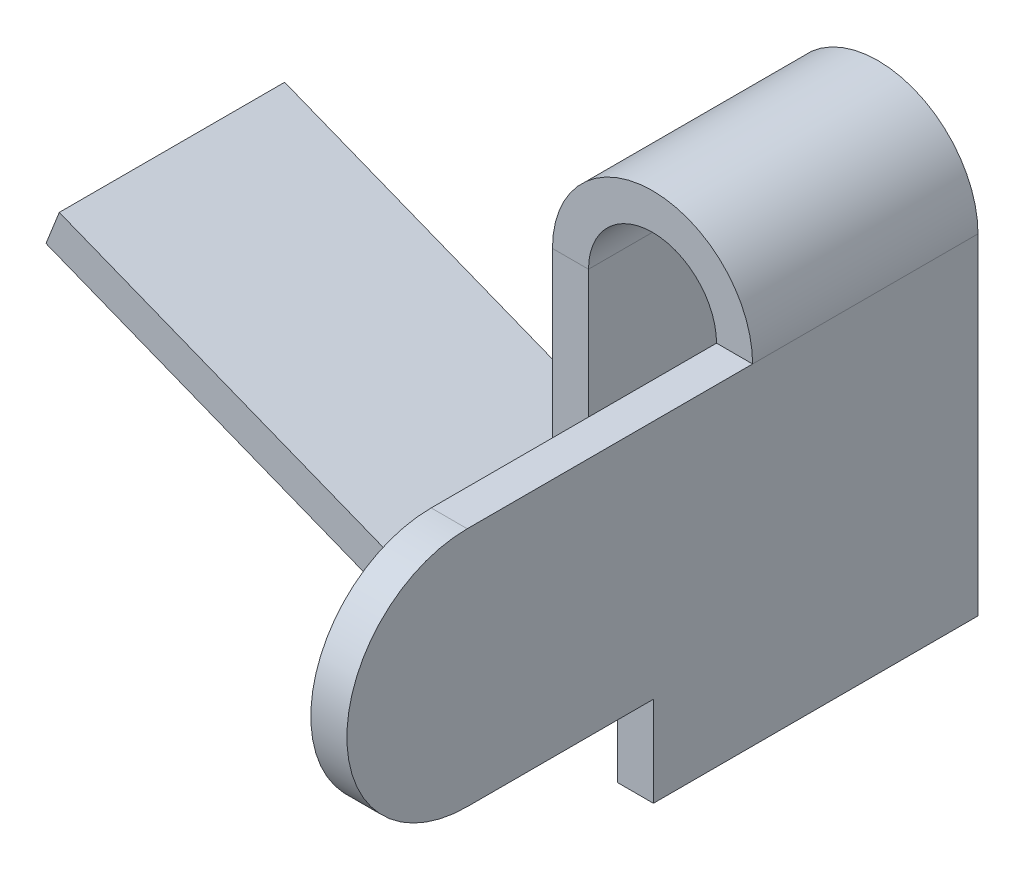
from build123d import *

# Parameters (mm, degrees)
BASE_FLANGE1_DEPTH  = 2.5
SKETCH6_W           = 0.4
SKETCH6_H           = 3.67
BOSS_EXTRUDE1_DEPTH = 4.5
SKETCH7_W           = 3.4
SKETCH7_H           = 1
CUT_EXTRUDE1_DEPTH  = 4.5
FILLET1_RADIUS      = 1.335
FILLET1_LENGTH      = 0.4


# Sheet-metal steps are written as plain solids
with BuildPart() as part:
    # Sketch1 → Base-Flange1 (new body)
    with BuildSketch(Plane.XY):
        with BuildLine():
            Line((0.71, 0), (0.71, 3.67))
            ThreePointArc((0.71, 3.67), (0, 4.38), (-0.71, 3.67))
            Line((-0.71, 3.67), (-0.71, -0.5))
            ThreePointArc((-0.71, -0.5), (-0.998929703, -1.045808423), (-1.612747985, -1.113737253))
            Line((-1.612747985, -1.113737253), (-6.727225094, 0.909162621))
            Line((-6.727225094, 0.909162621), (-6.580105103, 1.281124592))
            Line((-6.580105103, 1.281124592), (-1.465627994, -0.741775282))
            ThreePointArc((-1.465627994, -0.741775282), (-1.223820792, -0.71501544), (-1.11, -0.5))
            Line((-1.11, -0.5), (-1.11, 3.67))
            ThreePointArc((-1.11, 3.67), (0, 4.78), (1.11, 3.67))
            Line((1.11, 3.67), (1.11, 0))
            Line((1.11, 0), (0.71, 0))
        make_face()
    extrude(amount=BASE_FLANGE1_DEPTH)

    # Sketch6 → Boss-Extrude1 (add)
    with BuildSketch(Plane.XY.offset(2.5)):
        with Locations((0.91, 1.835)):
            Rectangle(SKETCH6_W, SKETCH6_H)
    extrude(amount=BOSS_EXTRUDE1_DEPTH)

    # Sketch7 → Cut-Extrude1 (cut)
    with BuildSketch(Plane(origin=(1.11, 0, 0), x_dir=(0, 0, -1), z_dir=(1, 0, 0))):
        with Locations((-5.3, 0.5)):
            Rectangle(SKETCH7_W, SKETCH7_H)
    extrude(amount=-CUT_EXTRUDE1_DEPTH, mode=Mode.SUBTRACT)

    # Fillet1: full round fillet: the end face becomes a half cylinder, R = half its width
    fillet1_face = Plane((0.91, 2.335, 7), x_dir=(-1, 0, 0), z_dir=(0, 0, 1))  # on the end face: x along it, z out of the body
    fillet1_slab = fillet1_face.offset(-FILLET1_RADIUS / 2) * Box(FILLET1_LENGTH, 2 * FILLET1_RADIUS, FILLET1_RADIUS, mode=Mode.PRIVATE)  # the body's end, R deep
    fillet1_round = Plane((0.91, 2.335, 5.665), x_dir=(0, 0, 1), z_dir=(-1, 0, 0)) * Cylinder(FILLET1_RADIUS, FILLET1_LENGTH, mode=Mode.PRIVATE)  # its axis R under the face
    add(fillet1_slab - fillet1_round, mode=Mode.SUBTRACT)


solid = part.part
